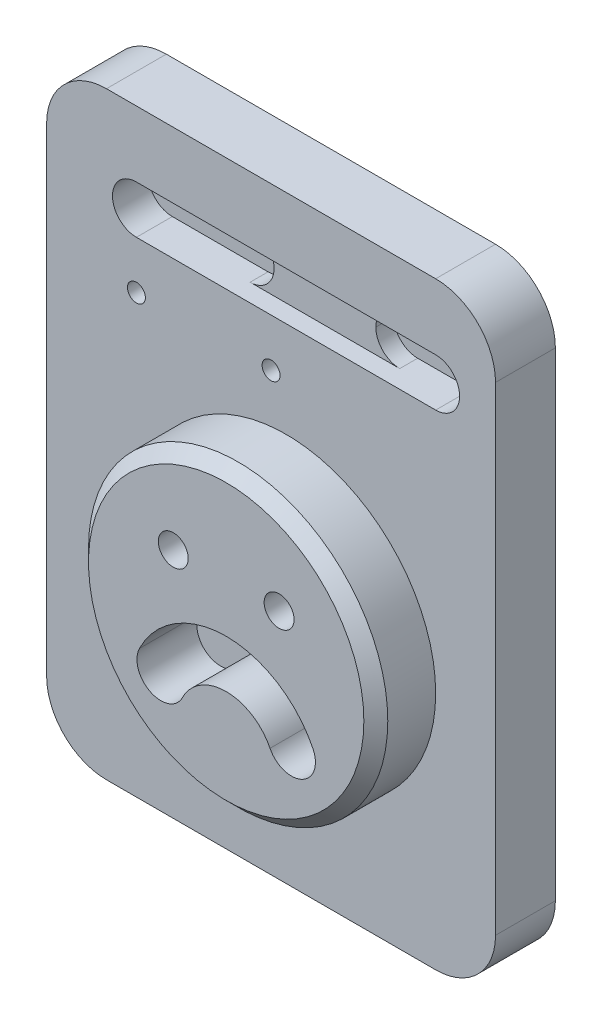
from build123d import *

# Parameters (mm, degrees)
SKETCH2_W                    = 75
SKETCH2_H                    = 100
BOSS_EXTRUDE1_DEPTH          = 10
BOSS_EXTRUDE4_DEPTH          = 10
F_5_0_5_DIAMETER_HOLE1_D     = 5
CUT_EXTRUDE1_DEPTH           = 6
FILLET1_R                    = 10
F_3_0_3_DIAMETER_HOLE1_D     = 3
F_3_0_3_DIAMETER_HOLE1_DEPTH = 10
F_3_0_3_DIAMETER_HOLE1_TIP   = 0.901290929
SKETCH18_W                   = 17
SKETCH18_H                   = 8
BOSS_EXTRUDE5_DEPTH          = 3
FILLET2_R                    = 4
CUT_EXTRUDE2_DEPTH           = 10
CHAMFER1_SIZE                = 2


with BuildPart() as part:
    # Sketch2 → Boss-Extrude1 (new body)
    with BuildSketch(Plane.XY):
        with Locations((37.5, 50)):
            Rectangle(SKETCH2_W, SKETCH2_H)
    extrude(amount=BOSS_EXTRUDE1_DEPTH)

    # Sketch5 → Boss-Extrude4 (add)
    with BuildSketch(Plane.XY.offset(10)):
        with BuildLine():
            ThreePointArc((25.222170949, 60.16471593), (40, 15), (54.777829051, 60.16471593))
            ThreePointArc((54.777829051, 60.16471593), (51.923594578, 61.973345042), (48.851534275, 63.380554762))
            ThreePointArc((48.851534275, 63.380554762), (40, 65), (31.148465725, 63.380554762))
            ThreePointArc((31.148465725, 63.380554762), (28.076405422, 61.973345042), (25.222170949, 60.16471593))
        make_face()
    extrude(amount=BOSS_EXTRUDE4_DEPTH)

    # Ø5.0 (5) Diameter Hole1 (through all)
    with Locations(Plane.XY.offset(20)):
        with Locations((31.161165235, 48.838834765), (48.838834765, 48.838834765)):
            Hole(F_5_0_5_DIAMETER_HOLE1_D / 2)

    # Sketch12 → Cut-Extrude1 (cut)
    with BuildSketch(Plane.XY.offset(10)):
        with BuildLine():
            Line((15, 89), (65, 89))
            ThreePointArc((65, 89), (69, 85), (65, 81))
            Line((65, 81), (15, 81))
            ThreePointArc((15, 81), (11, 85), (15, 89))
        make_face()
    extrude(amount=-CUT_EXTRUDE1_DEPTH, mode=Mode.SUBTRACT)

    # Fillet1
    fillet1_edges = [part.edges().sort_by_distance(p)[0] for p in [
        (0, 100, 5),
        (75, 100, 5),
        (75, 0, 5),
        (0, 0, 5),
    ]]
    fillet(fillet1_edges, radius=FILLET1_R)

    # Ø3.0 (3) Diameter Hole1
    with Locations(Plane.XY.offset(10)):
        with Locations((15, 73), (37.5, 73)):
            Hole(F_3_0_3_DIAMETER_HOLE1_D / 2, depth=F_3_0_3_DIAMETER_HOLE1_DEPTH)
            with Locations((0, 0, -(F_3_0_3_DIAMETER_HOLE1_DEPTH + F_3_0_3_DIAMETER_HOLE1_TIP / 2))):  # 118° drill point
                Cone(0, F_3_0_3_DIAMETER_HOLE1_D / 2, F_3_0_3_DIAMETER_HOLE1_TIP, mode=Mode.SUBTRACT)

    # Sketch18 → Boss-Extrude5 (add)
    with BuildSketch(Plane.XY.offset(4)):
        with Locations((43.5, 85)):
            Rectangle(SKETCH18_W, SKETCH18_H)
    extrude(amount=BOSS_EXTRUDE5_DEPTH)

    # Fillet2
    fillet2_edges = [part.edges().sort_by_distance(p)[0] for p in [
        (52, 81, 5.5),
        (52, 89, 5.5),
        (35, 81, 5.5),
        (35, 89, 5.5),
    ]]
    fillet(fillet2_edges, radius=FILLET2_R - 0.0001)  # a hair under: the kernel refuses the full size

    # Sketch20 → Cut-Extrude2 (cut)
    with BuildSketch(Plane.XY.offset(20)):
        with BuildLine():
            ThreePointArc((54.498623519, 31.756776834), (40, 40.773853631), (25.501376481, 31.756776834))
            ThreePointArc((25.501376481, 31.756776834), (27.320380503, 26.400357846), (32.67679949, 28.219361868))
            ThreePointArc((32.67679949, 28.219361868), (40, 32.773853631), (47.32320051, 28.219361868))
            ThreePointArc((47.32320051, 28.219361868), (52.679619497, 26.400357846), (54.498623519, 31.756776834))
        make_face()
    extrude(amount=-CUT_EXTRUDE2_DEPTH, mode=Mode.SUBTRACT)

    # Chamfer1
    chamfer1_edges = [part.edges().sort_by_distance(p)[0] for p in [
        (25.222170949, 19.83528407, 20),
    ]]
    chamfer(chamfer1_edges, length=CHAMFER1_SIZE)


solid = part.part
